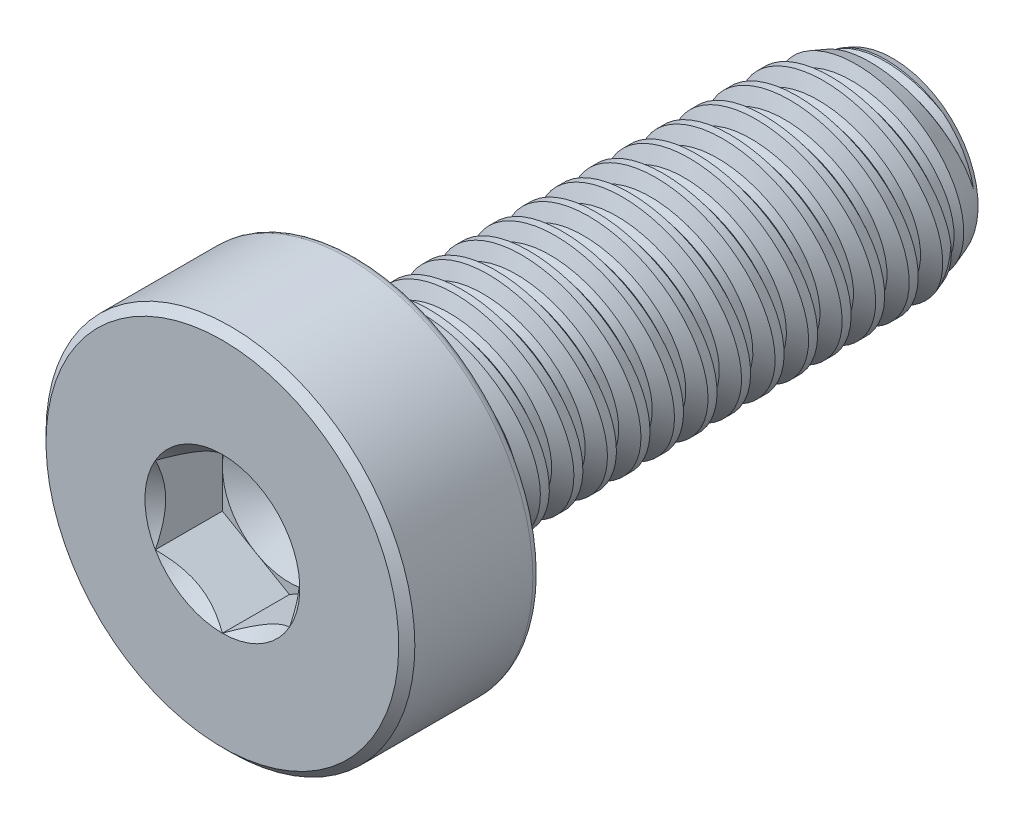
from build123d import *

# Parameters (mm, degrees)
SKETCH1_W            = 8
SKETCH1_H            = 1.5
LPATTERN1_COUNT      = 16
LPATTERN1_PITCH      = 0.5
LPATTERN1_COUNT_DIR2 = 2
LPATTERN1_PITCH_DIR2 = 0.5
SKETCH4_R            = 2.75
EXTRUDE1_DEPTH       = 2
CUT_EXTRUDE1_DEPTH   = 1
SKETCH7_R            = 1.154700538
CUT_EXTRUDE4_DEPTH   = 1
CUT_EXTRUDE4_DRAFT   = -45
SKETCH8_R            = 1
CUT_EXTRUDE5_DEPTH   = 0.333333333
CUT_EXTRUDE5_DRAFT   = -60


with BuildPart() as part:
    # Sketch1 → Revolve1 (revolve)
    with BuildSketch(Plane(origin=(0, 0, 0), x_dir=(0, 0, -1), z_dir=(1, 0, 0)), mode=Mode.PRIVATE) as revolve1_sk:
        with Locations((4, 0.75)):
            Rectangle(SKETCH1_W, SKETCH1_H)
    revolve(revolve1_sk.sketch.rotate(Axis((0, 0, 0), (0, 0, 1)), 143.496238264), axis=Axis((0, 0, 0), (0, 0, 1)))

    # Sketch2 → Cut-Revolve1 (revolve, cut)
    with BuildSketch(Plane(origin=(0, 0, 0), x_dir=(0, 0, -1), z_dir=(1, 0, 0)), mode=Mode.PRIVATE) as cut_revolve1_sk:
        Polygon((0.06164962, 1.510274937), (0.493196962, 1.582199494), (0.383564692, 1.289561466), (0.260265452, 1.269011592), align=None)
    cut_revolve1 = revolve(cut_revolve1_sk.sketch.rotate(Axis((0, -0.089188249, 0), (0, 0.1643989873053575, -0.9863939238321437)), 180), axis=Axis((0, -0.089188249, 0), (0, 0.1643989873053575, -0.9863939238321437)), mode=Mode.SUBTRACT)

    # Sketch3 → Cut-Revolve2 (revolve, cut)
    with BuildSketch(Plane(origin=(0, 0, 0), x_dir=(0, 0, -1), z_dir=(1, 0, 0)), mode=Mode.PRIVATE) as cut_revolve2_sk:
        Polygon((8, 1.269011592), (7.365364565, 1.5), (8, 1.5), align=None)
    revolve(cut_revolve2_sk.sketch.rotate(Axis((0, 0, -7.365364565), (0, 0, 1)), 143.496238264), axis=Axis((0, 0, -7.365364565), (0, 0, 1)), mode=Mode.SUBTRACT)

    # LPattern1: Cut-Revolve1 16 × 2
    with Locations(*[Vector(0, 0, -1) * (i * LPATTERN1_PITCH) + Vector(0, 0, 1) * (j * LPATTERN1_PITCH_DIR2) for i in range(LPATTERN1_COUNT) for j in range(LPATTERN1_COUNT_DIR2) if (i, j) != (0, 0)]):
        add(cut_revolve1, mode=Mode.SUBTRACT)

    # Sketch4 → Extrude1 (add)
    with BuildSketch(Plane.XY):
        with Locations(Location((0, 0, 0), (0, 0, 90))):
            Circle(SKETCH4_R)
    extrude(amount=EXTRUDE1_DEPTH)

    # Sketch10 → Cut-Revolve3 (revolve, cut)
    with BuildSketch(Plane(origin=(0, 0, 0), x_dir=(0, 0, -1), z_dir=(1, 0, 0))):
        with BuildLine():
            Line((-2, 2.63), (-1.88, 2.75))
            Line((-1.88, 2.75), (-0.12, 2.75))
            ThreePointArc((-0.12, 2.75), (-0.035147186, 2.714852814), (0, 2.63))
            Line((0, 2.63), (0.1, 2.63))
            Line((0.1, 2.63), (0.1, 2.85))
            Line((0.1, 2.85), (-2, 2.85))
            Line((-2, 2.85), (-2, 2.63))
        make_face()
    revolve(axis=Axis((0, 0, 2), (0, 0, 1)), mode=Mode.SUBTRACT)

    # Sketch6 → Cut-Extrude1 (cut)
    with BuildSketch(Plane.XY.offset(2)):
        Polygon((0, -1.154700538), (1, -0.577350269), (1, 0.577350269), (0, 1.154700538), (-1, 0.577350269), (-1, -0.577350269), align=None)
    extrude(amount=-CUT_EXTRUDE1_DEPTH, mode=Mode.SUBTRACT)


with BuildPart() as cut_extrude4_tool:
    # Sketch7 → Cut-Extrude4 (with draft: the straight prism first)
    with BuildSketch(Plane.XY.offset(2)):
        Circle(SKETCH7_R)
    extrude(amount=-CUT_EXTRUDE4_DEPTH)
    # Cut-Extrude4: the draft: its side faces are tilted about the plane it starts from
    cut_extrude4_sides = [cut_extrude4_tool.faces().sort_by_distance(p)[0] for p in [
        (-1.154700538, 0, 1.5),
    ]]
    draft(cut_extrude4_sides, Plane.XY.offset(2), CUT_EXTRUDE4_DRAFT)


with BuildPart() as part_1:
    add(part.part)

    # Cut-Extrude4: cut by cut_extrude4_tool
    add(cut_extrude4_tool.part, mode=Mode.SUBTRACT)


with BuildPart() as cut_extrude5_tool:
    # Sketch8 → Cut-Extrude5 (with draft: the straight prism first)
    with BuildSketch(Plane.XY.offset(1)):
        Circle(SKETCH8_R)
    extrude(amount=-CUT_EXTRUDE5_DEPTH)
    # Cut-Extrude5: the draft: its side faces are tilted about the plane it starts from
    cut_extrude5_sides = [cut_extrude5_tool.faces().sort_by_distance(p)[0] for p in [
        (-1, 0, 0.833333333),
    ]]
    draft(cut_extrude5_sides, Plane.XY.offset(1), CUT_EXTRUDE5_DRAFT)


with BuildPart() as part_2:
    add(part_1.part)

    # Cut-Extrude5: cut by cut_extrude5_tool
    add(cut_extrude5_tool.part, mode=Mode.SUBTRACT)


solid = part_2.part
